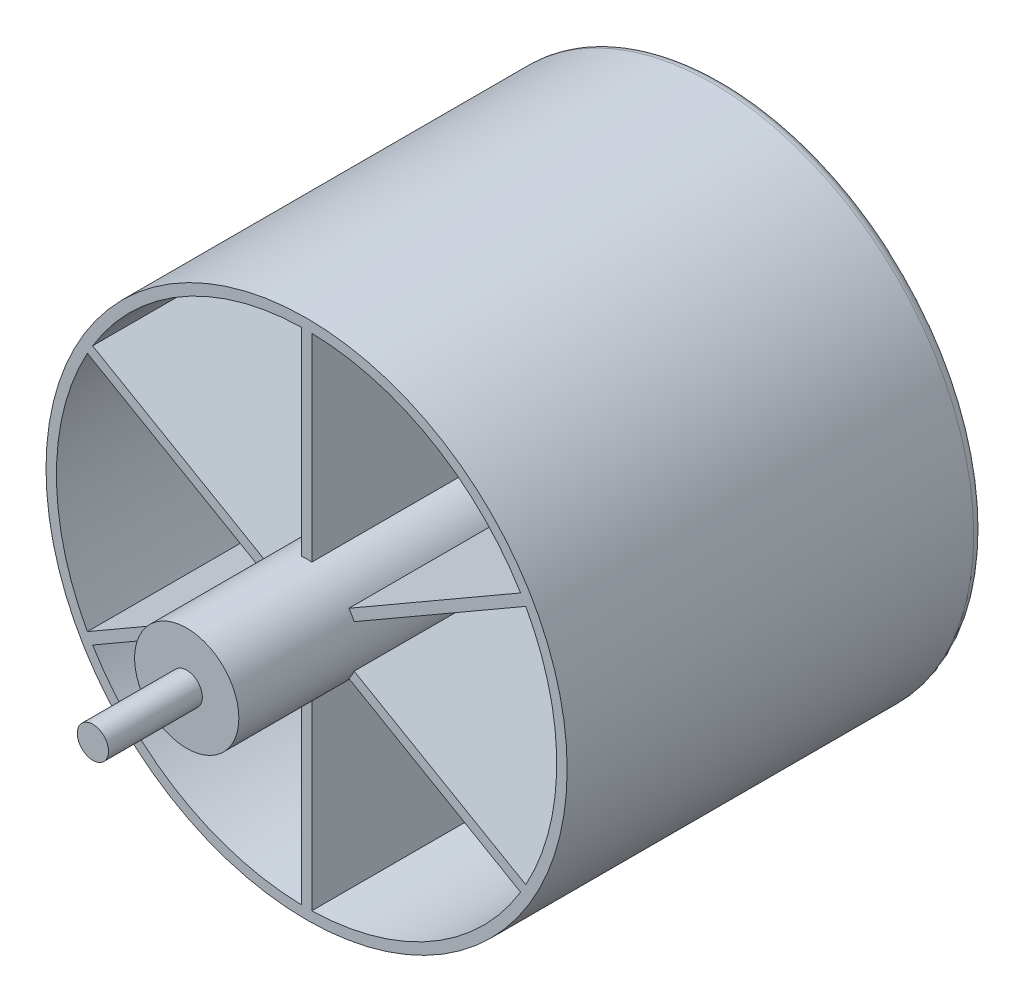
from build123d import *
from build123d.topology import SkipClean

# Parameters (mm, degrees)
SKETCH_1_R          = 50
EXTRUDE_1_DEPTH     = 80
SHELL_1_T           = -2
SKETCH_2_R          = 8
EXTRUDE_2_DEPTH     = 78
CUT_EXTRUDE_1_DEPTH = 150
EXTRUDE_START       = -5
SKETCH_4_R          = 7.5
SKETCH_4_R_2        = 5
EXTRUDE_3_DEPTH     = 5
CUT_EXTRUDE_START   = -5
SKETCH_5_R          = 8
CUT_EXTRUDE_2_DEPTH = 5
SKETCH_6_R          = 7.5
SKETCH_6_R_2        = 5
EXTRUDE_5_DEPTH     = 5
FILLET_1_R          = 2


with BuildPart() as part:
    # 草图1 → 凸台-拉伸1 (new body)
    with BuildSketch(Plane.XY):
        Circle(SKETCH_1_R)
    extrude(amount=EXTRUDE_1_DEPTH)

    # 抽壳1
    shell_1_openings = [part.faces().sort_by_distance(p)[0] for p in [
        (0, 0, 80),
    ]]
    offset(amount=SHELL_1_T, openings=shell_1_openings, kind=Kind.INTERSECTION)

    # 草图2 → 凸台-拉伸2 (add)
    with BuildSketch(Plane.XY.offset(2)):
        with BuildLine():
            Line((-1, 9.949874371), (-1, 47.989582203))
            ThreePointArc((-1, 47.989582203), (0, 48), (1, 47.989582203))
            Line((1, 47.989582203), (1, 9.949874371))
            ThreePointArc((1, 9.949874371), (5, 8.660254038), (8.11684397, 5.840962589))
            Line((8.11684397, 5.840962589), (41.060197305, 24.860816505))
            ThreePointArc((41.060197305, 24.860816505), (41.569219382, 24), (42.060197305, 23.128765698))
            Line((42.060197305, 23.128765698), (9.11684397, 4.108911782))
            ThreePointArc((9.11684397, 4.108911782), (10, 0), (9.11684397, -4.108911782))
            Line((9.11684397, -4.108911782), (42.060197305, -23.128765698))
            ThreePointArc((42.060197305, -23.128765698), (41.569219382, -24), (41.060197305, -24.860816505))
            Line((41.060197305, -24.860816505), (8.11684397, -5.840962589))
            ThreePointArc((8.11684397, -5.840962589), (5, -8.660254038), (1, -9.949874371))
            Line((1, -9.949874371), (1, -47.989582203))
            ThreePointArc((1, -47.989582203), (0, -48), (-1, -47.989582203))
            Line((-1, -47.989582203), (-1, -9.949874371))
            ThreePointArc((-1, -9.949874371), (-5, -8.660254038), (-8.11684397, -5.840962589))
            Line((-8.11684397, -5.840962589), (-41.060197305, -24.860816505))
            ThreePointArc((-41.060197305, -24.860816505), (-41.569219382, -24), (-42.060197305, -23.128765698))
            Line((-42.060197305, -23.128765698), (-9.11684397, -4.108911782))
            ThreePointArc((-9.11684397, -4.108911782), (-10, 0), (-9.11684397, 4.108911782))
            Line((-9.11684397, 4.108911782), (-42.060197305, 23.128765698))
            ThreePointArc((-42.060197305, 23.128765698), (-41.569219382, 24), (-41.060197305, 24.860816505))
            Line((-41.060197305, 24.860816505), (-8.11684397, 5.840962589))
            ThreePointArc((-8.11684397, 5.840962589), (-5, 8.660254038), (-1, 9.949874371))
        make_face()
        Circle(SKETCH_2_R, mode=Mode.SUBTRACT)
    extrude(amount=EXTRUDE_2_DEPTH)

    # 草图3 → 切除-拉伸1 (cut)
    with BuildSketch(Plane.XY.offset(2)):
        with BuildLine():
            Line((-16.124515497, 16.124515497), (-26.076809621, 26.076809621))
            ThreePointArc((-26.076809621, 26.076809621), (-26.953018892, 28.319851819), (-25.897826246, 30.484464826))
            ThreePointArc((-25.897826246, 30.484464826), (-20, 34.641016151), (-13.451407838, 37.670407845))
            ThreePointArc((-13.451407838, 37.670407845), (-11.049201661, 37.501924979), (-9.544774771, 35.621584392))
            Line((-9.544774771, 35.621584392), (-5.901982295, 22.026497792))
            ThreePointArc((-5.901982295, 22.026497792), (-6.10920272, 19.923050553), (-7.651965021, 18.478296223))
            ThreePointArc((-7.651965021, 18.478296223), (-10, 17.320508076), (-12.176691437, 15.865944209))
            ThreePointArc((-12.176691437, 15.865944209), (-14.19926654, 15.252250029), (-16.124515497, 16.124515497))
        make_face()
        with BuildLine():
            Line((16.124515497, 16.124515497), (26.076809621, 26.076809621))
            ThreePointArc((26.076809621, 26.076809621), (26.953018892, 28.319851819), (25.897826246, 30.484464826))
            ThreePointArc((25.897826246, 30.484464826), (20, 34.641016151), (13.451407838, 37.670407845))
            ThreePointArc((13.451407838, 37.670407845), (11.049201661, 37.501924979), (9.544774771, 35.621584392))
            Line((9.544774771, 35.621584392), (5.901982295, 22.026497792))
            ThreePointArc((5.901982295, 22.026497792), (6.10920272, 19.923050553), (7.651965021, 18.478296223))
            ThreePointArc((7.651965021, 18.478296223), (10, 17.320508076), (12.176691437, 15.865944209))
            ThreePointArc((12.176691437, 15.865944209), (14.19926654, 15.252250029), (16.124515497, 16.124515497))
        make_face()
        with BuildLine():
            Line((22.026497792, -5.901982295), (35.621584392, -9.544774771))
            ThreePointArc((35.621584392, -9.544774771), (38.002220553, -9.182073159), (39.349234083, -7.185943018))
            ThreePointArc((39.349234083, -7.185943018), (40, 0), (39.349234083, 7.185943018))
            ThreePointArc((39.349234083, 7.185943018), (38.002220553, 9.182073159), (35.621584392, 9.544774771))
            Line((35.621584392, 9.544774771), (22.026497792, 5.901982295))
            ThreePointArc((22.026497792, 5.901982295), (20.30846926, 4.670800524), (19.828656459, 2.612352014))
            ThreePointArc((19.828656459, 2.612352014), (20, 0), (19.828656459, -2.612352014))
            ThreePointArc((19.828656459, -2.612352014), (20.30846926, -4.670800524), (22.026497792, -5.901982295))
        make_face()
        with BuildLine():
            Line((5.901982295, -22.026497792), (9.544774771, -35.621584392))
            ThreePointArc((9.544774771, -35.621584392), (11.049201661, -37.501924979), (13.451407838, -37.670407845))
            ThreePointArc((13.451407838, -37.670407845), (20, -34.641016151), (25.897826246, -30.484464826))
            ThreePointArc((25.897826246, -30.484464826), (26.953018892, -28.319851819), (26.076809621, -26.076809621))
            Line((26.076809621, -26.076809621), (16.124515497, -16.124515497))
            ThreePointArc((16.124515497, -16.124515497), (14.19926654, -15.252250029), (12.176691437, -15.865944209))
            ThreePointArc((12.176691437, -15.865944209), (10, -17.320508076), (7.651965021, -18.478296223))
            ThreePointArc((7.651965021, -18.478296223), (6.10920272, -19.923050553), (5.901982295, -22.026497792))
        make_face()
        with BuildLine():
            Line((-16.124515497, -16.124515497), (-26.076809621, -26.076809621))
            ThreePointArc((-26.076809621, -26.076809621), (-26.953018892, -28.319851819), (-25.897826246, -30.484464826))
            ThreePointArc((-25.897826246, -30.484464826), (-20, -34.641016151), (-13.451407838, -37.670407845))
            ThreePointArc((-13.451407838, -37.670407845), (-11.049201661, -37.501924979), (-9.544774771, -35.621584392))
            Line((-9.544774771, -35.621584392), (-5.901982295, -22.026497792))
            ThreePointArc((-5.901982295, -22.026497792), (-6.10920272, -19.923050553), (-7.651965021, -18.478296223))
            ThreePointArc((-7.651965021, -18.478296223), (-10, -17.320508076), (-12.176691437, -15.865944209))
            ThreePointArc((-12.176691437, -15.865944209), (-14.19926654, -15.252250029), (-16.124515497, -16.124515497))
        make_face()
        with BuildLine():
            Line((-22.026497792, 5.901982295), (-35.621584392, 9.544774771))
            ThreePointArc((-35.621584392, 9.544774771), (-38.002220553, 9.182073159), (-39.349234083, 7.185943018))
            ThreePointArc((-39.349234083, 7.185943018), (-40, 0), (-39.349234083, -7.185943018))
            ThreePointArc((-39.349234083, -7.185943018), (-38.002220553, -9.182073159), (-35.621584392, -9.544774771))
            Line((-35.621584392, -9.544774771), (-22.026497792, -5.901982295))
            ThreePointArc((-22.026497792, -5.901982295), (-20.30846926, -4.670800524), (-19.828656459, -2.612352014))
            ThreePointArc((-19.828656459, -2.612352014), (-20, 0), (-19.828656459, 2.612352014))
            ThreePointArc((-19.828656459, 2.612352014), (-20.30846926, 4.670800524), (-22.026497792, 5.901982295))
        make_face()
    extrude(amount=-CUT_EXTRUDE_1_DEPTH, mode=Mode.SUBTRACT)

    # 草图5 → 切除-拉伸2 (cut)
    with BuildSketch(Plane.XY.offset(2).offset(CUT_EXTRUDE_START)):
        Circle(SKETCH_5_R)
    extrude(amount=CUT_EXTRUDE_2_DEPTH, mode=Mode.SUBTRACT)

    # 圆角1
    fillet_1_edges = [part.edges().sort_by_distance(p)[0] for p in [
        (1, -28.969728287, 2),
        (5, -8.660254038, 2),
        (24.588520637, -15.350889547, 2),
        (24, -41.569219382, 2),
        (21.100662559, -21.100662559, 2),
        (14.19926654, -15.252250029, 2),
        (10, -17.320508076, 2),
        (6.10920272, -19.923050553, 2),
        (7.723378533, -28.824041092, 2),
        (11.049201661, -37.501924979, 2),
        (20, -34.641016151, 2),
        (26.953018892, -28.319851819, 2),
        (25.588520637, -13.61883874, 2),
        (10, 0, 2),
        (25.588520637, 13.61883874, 2),
        (48, 0, 2),
        (40, 0, 2),
        (38.002220553, 9.182073159, 2),
        (28.824041092, 7.723378533, 2),
        (20.30846926, 4.670800524, 2),
        (20, 0, 2),
        (20.30846926, -4.670800524, 2),
        (28.824041092, -7.723378533, 2),
        (38.002220553, -9.182073159, 2),
        (24.588520637, 15.350889547, 2),
        (5, 8.660254038, 2),
        (1, 28.969728287, 2),
        (24, 41.569219382, 2),
        (10, 17.320508076, 2),
        (14.19926654, 15.252250029, 2),
        (21.100662559, 21.100662559, 2),
        (26.953018892, 28.319851819, 2),
        (20, 34.641016151, 2),
        (11.049201661, 37.501924979, 2),
        (7.723378533, 28.824041092, 2),
        (6.10920272, 19.923050553, 2),
        (-24.588520637, 15.350889547, 2),
        (-24, 41.569219382, 2),
        (-1, 28.969728287, 2),
        (-5, 8.660254038, 2),
        (-20, 34.641016151, 2),
        (-26.953018892, 28.319851819, 2),
        (-21.100662559, 21.100662559, 2),
        (-14.19926654, 15.252250029, 2),
        (-10, 17.320508076, 2),
        (-6.10920272, 19.923050553, 2),
        (-7.723378533, 28.824041092, 2),
        (-11.049201661, 37.501924979, 2),
        (-24.588520637, -15.350889547, 2),
        (-5, -8.660254038, 2),
        (-1, -28.969728287, 2),
        (-24, -41.569219382, 2),
        (-10, -17.320508076, 2),
        (-14.19926654, -15.252250029, 2),
        (-21.100662559, -21.100662559, 2),
        (-26.953018892, -28.319851819, 2),
        (-20, -34.641016151, 2),
        (-11.049201661, -37.501924979, 2),
        (-7.723378533, -28.824041092, 2),
        (-6.10920272, -19.923050553, 2),
        (-25.588520637, 13.61883874, 2),
        (-10, 0, 2),
        (-25.588520637, -13.61883874, 2),
        (-48, 0, 2),
        (-20, 0, 2),
        (-20.30846926, 4.670800524, 2),
        (-28.824041092, 7.723378533, 2),
        (-38.002220553, 9.182073159, 2),
        (-40, 0, 2),
        (-38.002220553, -9.182073159, 2),
        (-28.824041092, -7.723378533, 2),
        (-20.30846926, -4.670800524, 2),
        (-50, 0, 0),
    ]]
    fillet(fillet_1_edges, radius=FILLET_1_R - 0.0001)  # a hair under: the kernel refuses the full size

    # 草图7 → 旋转1 (revolve)
    with SkipClean():  # the faces are left unmerged after this step: merging them gives an invalid solid
        with BuildSketch(Plane(origin=(0, 0, 0), x_dir=(1, 0, 0), z_dir=(0, 1, 0)), mode=Mode.PRIVATE) as revolve_1_sk:
            Polygon((-10, -80), (-10, -101), (-10, -103), (-3, -103), (-3, -121), (0, -121), (0, -101), (-8, -101), (-8, -80), align=None)
        revolve(revolve_1_sk.sketch.rotate(Axis((0, 0, 1000), (0, 0, -1)), 180), axis=Axis((0, 0, 1000), (0, 0, -1)))


with BuildPart() as body_2:
    # 草图4 → 凸台-拉伸3 (new body)
    with BuildSketch(Plane.XY.offset(80).offset(EXTRUDE_START)):
        Circle(SKETCH_4_R)
        Circle(SKETCH_4_R_2, mode=Mode.SUBTRACT)
    extrude(amount=-EXTRUDE_3_DEPTH)


with BuildPart() as body_3:
    # 草图6 → 凸台-拉伸5 (new body)
    with BuildSketch(Plane(origin=(0, 0, 0), x_dir=(-1, 0, 0), z_dir=(0, 0, -1)).offset(EXTRUDE_START)):
        Circle(SKETCH_6_R)
        Circle(SKETCH_6_R_2, mode=Mode.SUBTRACT)
    extrude(amount=-EXTRUDE_5_DEPTH)


solid = Compound([part.part, body_2.part, body_3.part])
